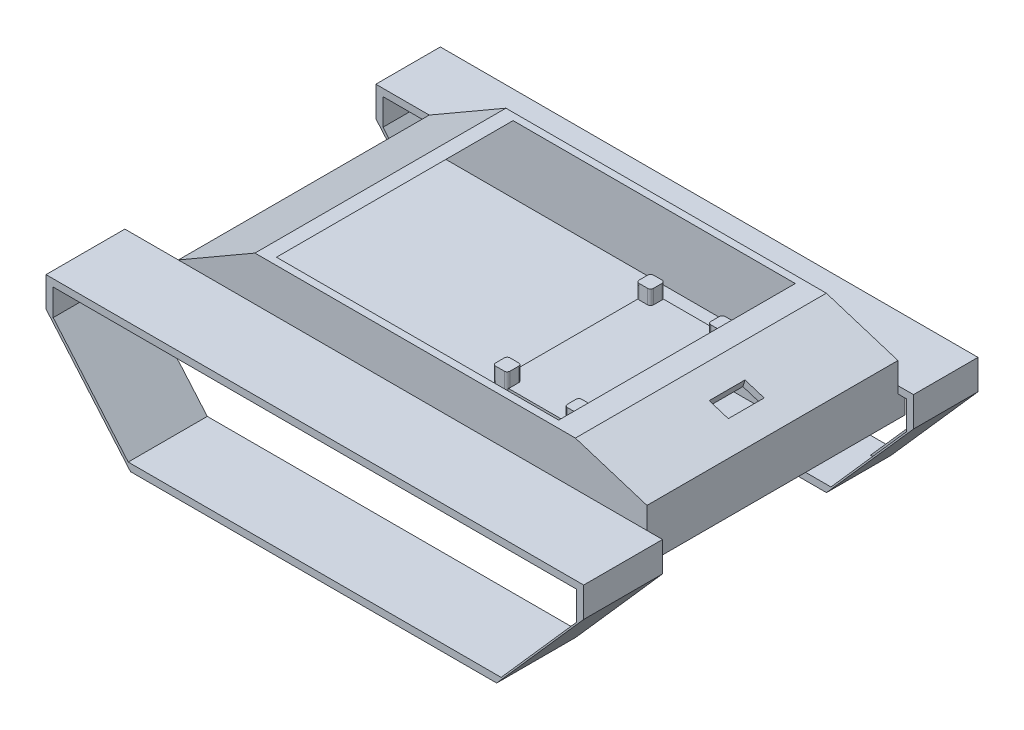
from build123d import *

# Parameters (mm, degrees)
BOSS_EXTRU_1_DEPTH            = 175
COQUE1_T                      = -5
BOSS_EXTRU_3_DEPTH            = 55
BOSS_EXTRU_3_DEPTH_BACK       = 220
ESQUISSE4_W                   = 174.846794054
ESQUISSE4_H                   = 68.749808593
ENL_V_MAT_EXTRU_2_DEPTH       = 440
ESQUISSE5_W                   = 10.839811776
ESQUISSE5_H                   = 175
ESQUISSE5_W_2                 = 37.291999076
ENL_V_MAT_EXTRU_3_DEPTH       = 440
COQUE2_START                  = 180
COQUE2_DEPTH                  = 50
COQUE2_START_2                = -45
COQUE2_2_DEPTH                = 40
COQUE2_START_3                = -5
COQUE2_3_OUTLINE_W            = 316.814624248
COQUE2_3_OUTLINE_H            = 10.798261423
COQUE2_3_DEPTH                = 185
COQUE2_START_4                = 179.846794054
COQUE2_4_DEPTH                = 0.153205946
ESQUISSE6_W                   = 320.386075269
ESQUISSE6_H                   = 165
BOSS_EXTRU_4_DEPTH            = 17
ESQUISSE8_W                   = 10
ESQUISSE8_H                   = 10.798261423
BOSS_EXTRU_5_DEPTH            = 322
ESQUISSE9_W                   = 10
ESQUISSE9_H                   = 10.798261423
BOSS_EXTRU_6_DEPTH            = 322
ESQUISSE10_W                  = 311.818773828
ESQUISSE10_H                  = 165
ENL_V_MAT_EXTRU_5_DEPTH       = 16
ESQUISSE12_W                  = 14
ESQUISSE12_H                  = 25
ENL_V_MAT_EXTRU_7_DEPTH       = 10
ESQUISSE13_W                  = 70
ESQUISSE13_H                  = 40
BOSS_EXTRU_7_DEPTH            = 30
ESQUISSE14_W                  = 60
ESQUISSE14_H                  = 110
BOSS_EXTRU_8_DEPTH            = 30
ESQUISSE15_W                  = 90
ESQUISSE15_H                  = 10
ENL_V_MAT_EXTRU_8_DEPTH       = 64
ESQUISSE16_W                  = 40
ESQUISSE16_H                  = 10
ENL_V_MAT_EXTRU_9_DEPTH       = 118
ESQUISSE17_W                  = 90
ESQUISSE17_H                  = 10
ENL_V_MAT_EXTRU_10_DEPTH      = 1
ESQUISSE18_W                  = 40
ESQUISSE18_H                  = 10.281843274
ENL_V_MAT_EXTRU_11_DEPTH      = 1
ESQUISSE19_W                  = 90
ESQUISSE19_H                  = 10
ENL_V_MAT_EXTRU_12_DEPTH      = 1
ESQUISSE20_W                  = 40
ESQUISSE20_H                  = 10.281843274
ENL_V_MAT_EXTRU_13_DEPTH      = 1
CONG_1_R                      = 2
ENL_V_MAT_EXTRU_14_DEPTH      = 307
ENL_V_MAT_EXTRU_14_DEPTH_BACK = 33


# Read off the part's stored shape, not the designer's step: Coque2
with BuildPart() as part:
    # Esquisse1 → Boss.-Extru.1 (new body)
    with BuildSketch(Plane.XY):
        Polygon((-177.5, -12.8515625), (177.5, -12.8515625), (177.5, 31.452730744), (127.578125, 47.1484375), (-95.881696429, 47.1484375), (-177.5, 0), align=None)
    extrude(amount=BOSS_EXTRU_1_DEPTH)

    # Coque1
    coque1_openings = [part.faces().sort_by_distance(p)[0] for p in [
        (15.848214286, 47.1484375, 87.5),
    ]]
    offset(amount=COQUE1_T, openings=coque1_openings, kind=Kind.INTERSECTION)

    # Esquisse3 → Boss.-Extru.3 (add, two sides: drawn at the far end of the back side and taken through both)
    with BuildSketch(Plane.XY.offset(175).offset(-BOSS_EXTRU_3_DEPTH_BACK)):
        Polygon((127.678215958, -73.266226742), (-127.678215958, -73.266226742), (-186.606623324, -4.516418149), (-186.606623324, 16.281843274), (167.541550352, 16.281843274), (188.339811776, 16.281843274), (188.339811776, -4.516418149), align=None)
    extrude(amount=BOSS_EXTRU_3_DEPTH + BOSS_EXTRU_3_DEPTH_BACK)

    # Esquisse4 → Enlèv. mat.-Extru.2 (cut)
    with BuildSketch(Plane.ZY.offset(186.606623324)):
        with Locations((87.423397027, -38.891322446)):
            Rectangle(ESQUISSE4_W, ESQUISSE4_H)
    extrude(amount=-ENL_V_MAT_EXTRU_2_DEPTH, mode=Mode.SUBTRACT)

    # Esquisse5 → Enlèv. mat.-Extru.3 (cut)
    with BuildSketch(Plane(origin=(0, 16.281843274, 0), x_dir=(1, 0, 0), z_dir=(0, 1, 0))):
        with Locations((182.919905888, -87.5)):
            Rectangle(ESQUISSE5_W, ESQUISSE5_H)
        with Locations((-167.960623786, -87.5)):
            Rectangle(ESQUISSE5_W_2, ESQUISSE5_H)
    extrude(amount=-ENL_V_MAT_EXTRU_3_DEPTH, mode=Mode.SUBTRACT)

    # Coque2 outline → Coque2 (cut)
    with BuildSketch(Plane.XY.offset(COQUE2_START)):
        Polygon((183.339811776, 11.281843274), (-181.606623324, 11.281843274), (-181.606623324, -2.666797768), (-125.378541346, -68.266226742), (125.4218724, -68.266226742), (183.339811776, -2.62589545), align=None)
    extrude(amount=COQUE2_DEPTH, mode=Mode.SUBTRACT)

    # Coque2 2 outline → Coque2 2 (cut)
    with BuildSketch(Plane.XY.offset(COQUE2_START_2)):
        Polygon((183.339811776, 11.281843274), (-181.606623324, 11.281843274), (-181.606623324, -2.666797768), (-125.378541346, -68.266226742), (125.4218724, -68.266226742), (183.339811776, -2.62589545), align=None)
    extrude(amount=COQUE2_2_DEPTH, mode=Mode.SUBTRACT)

    # Coque2 3 outline → Coque2 3 (cut)
    with BuildSketch(Plane.XY.offset(COQUE2_START_3)):
        with Locations((14.092687876, 5.882712563)):
            Rectangle(COQUE2_3_OUTLINE_W, COQUE2_3_OUTLINE_H)
    extrude(amount=COQUE2_3_DEPTH, mode=Mode.SUBTRACT)

    # Coque2 4 outline → Coque2 4 (cut)
    with BuildSketch(Plane.XY.offset(COQUE2_START_4)):
        Polygon((172.5, -14.911015462), (172.5, 0.483581851), (-144.314624248, 0.483581851), (-144.314624248, -46.174130022), (-125.378541346, -68.266226742), (125.4218724, -68.266226742), align=None)
    extrude(amount=COQUE2_4_DEPTH, mode=Mode.SUBTRACT)

    # Esquisse6 → Boss.-Extru.4 (add)
    with BuildSketch(Plane(origin=(0, 16.281843274, 0), x_dir=(1, 0, 0), z_dir=(0, 1, 0))):
        with Locations((12.306962365, -87.5)):
            Rectangle(ESQUISSE6_W, ESQUISSE6_H)
    extrude(amount=-BOSS_EXTRU_4_DEPTH)

    # Esquisse8 → Boss.-Extru.5 (add)
    with BuildSketch(Plane(origin=(-144.314624248, 0, 0), x_dir=(0, 0, -1), z_dir=(1, 0, 0))):
        with Locations((-175, 5.882712563)):
            Rectangle(ESQUISSE8_W, ESQUISSE8_H)
    extrude(amount=BOSS_EXTRU_5_DEPTH)

    # Esquisse9 → Boss.-Extru.6 (add)
    with BuildSketch(Plane.ZY.offset(-172.5)):
        with Locations((0, 5.882712563)):
            Rectangle(ESQUISSE9_W, ESQUISSE9_H)
    extrude(amount=BOSS_EXTRU_6_DEPTH)

    # Esquisse10 → Enlèv. mat.-Extru.5 (cut)
    with BuildSketch(Plane(origin=(0, 16.281843274, 0), x_dir=(1, 0, 0), z_dir=(0, 1, 0))):
        with Locations((16.590613086, -87.5)):
            Rectangle(ESQUISSE10_W, ESQUISSE10_H)
    extrude(amount=-ENL_V_MAT_EXTRU_5_DEPTH, mode=Mode.SUBTRACT)

    # Esquisse12 → Enlèv. mat.-Extru.7 (cut)
    with BuildSketch(Plane(origin=(24.966917974, 79.409954428, 0), x_dir=(0.9539610550737444, -0.2999305009541184, 0), z_dir=(0.2999305009541184, 0.9539610550737445, 0))):
        with Locations((133.728881119, -87.5)):
            Rectangle(ESQUISSE12_W, ESQUISSE12_H)
    extrude(amount=-ENL_V_MAT_EXTRU_7_DEPTH, mode=Mode.SUBTRACT)

    # Esquisse13 → Boss.-Extru.7 (add)
    with BuildSketch(Plane(origin=(0, 0.281843274, 0), x_dir=(1, 0, 0), z_dir=(0, 1, 0))):
        with Locations((137.5, -25)):
            Rectangle(ESQUISSE13_W, ESQUISSE13_H)
        with Locations((137.5, -150)):
            Rectangle(ESQUISSE13_W, ESQUISSE13_H)
    extrude(amount=BOSS_EXTRU_7_DEPTH)

    # Esquisse14 → Boss.-Extru.8 (add)
    with BuildSketch(Plane(origin=(0, 0.281843274, 0), x_dir=(1, 0, 0), z_dir=(0, 1, 0))):
        with Locations((67.5, -87.5)):
            Rectangle(ESQUISSE14_W, ESQUISSE14_H)
    extrude(amount=BOSS_EXTRU_8_DEPTH)

    # Esquisse15 → Enlèv. mat.-Extru.8 (cut)
    with BuildSketch(Plane.ZY.offset(-37.5)):
        with Locations((87.5, 5.281843274)):
            Rectangle(ESQUISSE15_W, ESQUISSE15_H)
        with Locations((87.5, 25.281843274)):
            Rectangle(ESQUISSE15_W, ESQUISSE15_H)
    extrude(amount=-ENL_V_MAT_EXTRU_8_DEPTH, mode=Mode.SUBTRACT)

    # Esquisse16 → Enlèv. mat.-Extru.9 (cut)
    with BuildSketch(Plane(origin=(0, 0, 32.5), x_dir=(-1, 0, 0), z_dir=(0, 0, -1))):
        with Locations((-67.5, 5)):
            Rectangle(ESQUISSE16_W, ESQUISSE16_H)
        with Locations((-67.5, 25.281843274)):
            Rectangle(ESQUISSE16_W, ESQUISSE16_H)
    extrude(amount=-ENL_V_MAT_EXTRU_9_DEPTH, mode=Mode.SUBTRACT)

    # Esquisse17 → Enlèv. mat.-Extru.10 (cut)
    with BuildSketch(Plane.ZY.offset(-37.5)):
        with Locations((87.5, 15.281843274)):
            Rectangle(ESQUISSE17_W, ESQUISSE17_H)
    extrude(amount=-ENL_V_MAT_EXTRU_10_DEPTH, mode=Mode.SUBTRACT)

    # Esquisse18 → Enlèv. mat.-Extru.11 (cut)
    with BuildSketch(Plane(origin=(0, 0, 32.5), x_dir=(-1, 0, 0), z_dir=(0, 0, -1))):
        with Locations((-67.5, 15.140921637)):
            Rectangle(ESQUISSE18_W, ESQUISSE18_H)
    extrude(amount=-ENL_V_MAT_EXTRU_11_DEPTH, mode=Mode.SUBTRACT)

    # Esquisse19 → Enlèv. mat.-Extru.12 (cut)
    with BuildSketch(Plane(origin=(97.5, 0, 0), x_dir=(0, 0, -1), z_dir=(1, 0, 0))):
        with Locations((-87.5, 15.281843274)):
            Rectangle(ESQUISSE19_W, ESQUISSE19_H)
    extrude(amount=-ENL_V_MAT_EXTRU_12_DEPTH, mode=Mode.SUBTRACT)

    # Esquisse20 → Enlèv. mat.-Extru.13 (cut)
    with BuildSketch(Plane.XY.offset(142.5)):
        with Locations((67.5, 15.140921637)):
            Rectangle(ESQUISSE20_W, ESQUISSE20_H)
    extrude(amount=-ENL_V_MAT_EXTRU_13_DEPTH, mode=Mode.SUBTRACT)

    # Congé1
    # the kernel refuses this fillet: 2 mm, written as the material it takes off along each edge
    with BuildSketch(Plane(origin=(87.5, 0.281843274, 132.5), x_dir=(0, 0, 1), z_dir=(0, 1, 0)), Plane(origin=(47.5, 10, 132.5), x_dir=(0, 0, 1), z_dir=(0, -1, 0)), Plane(origin=(47.5, 0.281843274, 42.5), x_dir=(0, 0, -1), z_dir=(0, 1, 0))) as cong_1_piece_1:
        with BuildLine():
            CenterArc((CONG_1_R, CONG_1_R), CONG_1_R, 180, 90)
            Line((0, CONG_1_R), (0, 0))
            Line((0, 0), (CONG_1_R, 0))
        make_face()
    extrude(amount=9.718156726, mode=Mode.SUBTRACT)
    with BuildSketch(Plane(origin=(87.5, 20.281843274, 132.5), x_dir=(0, 0, 1), z_dir=(0, 1, 0)), Plane(origin=(47.5, 35.281843274, 132.5), x_dir=(0, 0, 1), z_dir=(0, -1, 0)), Plane(origin=(47.5, 20.281843274, 42.5), x_dir=(0, 0, -1), z_dir=(0, 1, 0))) as cong_1_piece_2:
        with BuildLine():
            CenterArc((CONG_1_R, CONG_1_R), CONG_1_R, 180, 90)
            Line((0, CONG_1_R), (0, 0))
            Line((0, 0), (CONG_1_R, 0))
        make_face()
    extrude(amount=15, mode=Mode.SUBTRACT)
    with BuildSketch(Plane(origin=(87.5, 0.281843274, 142.5), x_dir=(1, 0, 0), z_dir=(0, 1, 0))) as cong_1_piece_3_section:
        with BuildLine():
            CenterArc((CONG_1_R, CONG_1_R), CONG_1_R, 180, 90)
            Line((0, CONG_1_R), (0, 0))
            Line((0, 0), (CONG_1_R, 0))
        make_face()
    cong_1_piece_3 = extrude(amount=35, mode=Mode.PRIVATE)
    cong_1_piece_3 = split(cong_1_piece_3, bisect_by=Plane(origin=(87.988049699, 5.140921637, 141.5), z_dir=(0, 0, 1)), keep=Keep.TOP, mode=Mode.PRIVATE)
    add(cong_1_piece_3, mode=Mode.SUBTRACT)
    with BuildSketch(Plane(origin=(87.5, 0.281843274, 142.5), x_dir=(1, 0, 0), z_dir=(0, 1, 0))) as cong_1_piece_4_section:
        with BuildLine():
            CenterArc((CONG_1_R, CONG_1_R), CONG_1_R, 180, 90)
            Line((0, CONG_1_R), (0, 0))
            Line((0, 0), (CONG_1_R, 0))
        make_face()
    cong_1_piece_4 = extrude(amount=35, mode=Mode.PRIVATE)
    cong_1_piece_4 = split(cong_1_piece_4, bisect_by=Plane(origin=(87.579369185, 10, 141.253472775), z_dir=(0, -1, 0)), keep=Keep.TOP, mode=Mode.PRIVATE)
    add(cong_1_piece_4, mode=Mode.SUBTRACT)
    with BuildSketch(Plane(origin=(87.5, -4.718156726, 142.5), x_dir=(1, 0, 0), z_dir=(0, 1, 0))) as cong_1_piece_5_section:
        with BuildLine():
            CenterArc((CONG_1_R, CONG_1_R), CONG_1_R, 180, 90)
            Line((0, CONG_1_R), (0, 0))
            Line((0, 0), (CONG_1_R, 0))
        make_face()
    cong_1_piece_5 = extrude(amount=40, mode=Mode.PRIVATE)
    cong_1_piece_5 = split(cong_1_piece_5, bisect_by=Plane(origin=(87.579369185, 20.281843274, 141.253472775), z_dir=(0, 1, 0)), keep=Keep.TOP, mode=Mode.PRIVATE)
    add(cong_1_piece_5, mode=Mode.SUBTRACT)
    with BuildSketch(Plane(origin=(97.5, 0.281843274, 142.5), x_dir=(-1, 0, 0), z_dir=(0, 1, 0))) as cong_1_piece_6:
        with BuildLine():
            CenterArc((CONG_1_R, -CONG_1_R), CONG_1_R, 90, 90)
            Line((0, -CONG_1_R), (0, 0))
            Line((0, 0), (CONG_1_R, 0))
        make_face()
    extrude(amount=35, mode=Mode.SUBTRACT)
    with BuildSketch(Plane(origin=(97.5, 0.281843274, 132.5), x_dir=(-1, 0, 0), z_dir=(0, 1, 0))) as cong_1_piece_7_section:
        with BuildLine():
            CenterArc((CONG_1_R, CONG_1_R), CONG_1_R, 180, 90)
            Line((0, CONG_1_R), (0, 0))
            Line((0, 0), (CONG_1_R, 0))
        make_face()
    cong_1_piece_7 = extrude(amount=35, mode=Mode.PRIVATE)
    cong_1_piece_7 = split(cong_1_piece_7, bisect_by=Plane(origin=(96.253472775, 10.281843274, 132.579369185), z_dir=(0, -1, 0)), keep=Keep.TOP, mode=Mode.PRIVATE)
    add(cong_1_piece_7, mode=Mode.SUBTRACT)
    with BuildSketch(Plane(origin=(97.5, -4.718156726, 132.5), x_dir=(-1, 0, 0), z_dir=(0, 1, 0))) as cong_1_piece_8_section:
        with BuildLine():
            CenterArc((CONG_1_R, CONG_1_R), CONG_1_R, 180, 90)
            Line((0, CONG_1_R), (0, 0))
            Line((0, 0), (CONG_1_R, 0))
        make_face()
    cong_1_piece_8 = extrude(amount=40, mode=Mode.PRIVATE)
    cong_1_piece_8 = split(cong_1_piece_8, bisect_by=Plane(origin=(97.14320814, 10.281843274, 132.988049699), z_dir=(0, 1, 0)), keep=Keep.TOP, mode=Mode.PRIVATE)
    cong_1_piece_8 = split(cong_1_piece_8, bisect_by=Plane(origin=(96.5, 15.281843274, 132.988049699), z_dir=(1, 0, 0)), keep=Keep.TOP, mode=Mode.PRIVATE)
    add(cong_1_piece_8, mode=Mode.SUBTRACT)
    with BuildSketch(Plane(origin=(97.5, -4.718156726, 132.5), x_dir=(-1, 0, 0), z_dir=(0, 1, 0))) as cong_1_piece_9_section:
        with BuildLine():
            CenterArc((CONG_1_R, CONG_1_R), CONG_1_R, 180, 90)
            Line((0, CONG_1_R), (0, 0))
            Line((0, 0), (CONG_1_R, 0))
        make_face()
    cong_1_piece_9 = extrude(amount=40, mode=Mode.PRIVATE)
    cong_1_piece_9 = split(cong_1_piece_9, bisect_by=Plane(origin=(96.253472775, 20.281843274, 132.579369185), z_dir=(0, 1, 0)), keep=Keep.TOP, mode=Mode.PRIVATE)
    add(cong_1_piece_9, mode=Mode.SUBTRACT)
    with BuildSketch(Plane(origin=(47.5, 35.281843274, 142.5), x_dir=(-1, 0, 0), z_dir=(0, -1, 0))) as cong_1_piece_10_section:
        with BuildLine():
            CenterArc((CONG_1_R, CONG_1_R), CONG_1_R, 180, 90)
            Line((0, CONG_1_R), (0, 0))
            Line((0, 0), (CONG_1_R, 0))
        make_face()
    cong_1_piece_10 = extrude(amount=35, mode=Mode.PRIVATE)
    cong_1_piece_10 = split(cong_1_piece_10, bisect_by=Plane(origin=(47.011950301, 25.281843274, 141.5), z_dir=(0, 0, 1)), keep=Keep.TOP, mode=Mode.PRIVATE)
    add(cong_1_piece_10, mode=Mode.SUBTRACT)
    with BuildSketch(Plane(origin=(47.5, 35.281843274, 142.5), x_dir=(-1, 0, 0), z_dir=(0, -1, 0))) as cong_1_piece_11_section:
        with BuildLine():
            CenterArc((CONG_1_R, CONG_1_R), CONG_1_R, 180, 90)
            Line((0, CONG_1_R), (0, 0))
            Line((0, 0), (CONG_1_R, 0))
        make_face()
    cong_1_piece_11 = extrude(amount=40, mode=Mode.PRIVATE)
    cong_1_piece_11 = split(cong_1_piece_11, bisect_by=Plane(origin=(47.420630815, 20.281843274, 141.253472775), z_dir=(0, 1, 0)), keep=Keep.TOP, mode=Mode.PRIVATE)
    add(cong_1_piece_11, mode=Mode.SUBTRACT)
    with BuildSketch(Plane(origin=(47.5, 35.281843274, 142.5), x_dir=(-1, 0, 0), z_dir=(0, -1, 0))) as cong_1_piece_12_section:
        with BuildLine():
            CenterArc((CONG_1_R, CONG_1_R), CONG_1_R, 180, 90)
            Line((0, CONG_1_R), (0, 0))
            Line((0, 0), (CONG_1_R, 0))
        make_face()
    cong_1_piece_12 = extrude(amount=35, mode=Mode.PRIVATE)
    cong_1_piece_12 = split(cong_1_piece_12, bisect_by=Plane(origin=(47.420630815, 10, 141.253472775), z_dir=(0, -1, 0)), keep=Keep.TOP, mode=Mode.PRIVATE)
    add(cong_1_piece_12, mode=Mode.SUBTRACT)
    with BuildSketch(Plane(origin=(37.5, 0.281843274, 142.5), x_dir=(1, 0, 0), z_dir=(0, 1, 0)), Plane(origin=(37.5, 0.281843274, 32.5), x_dir=(0, 0, 1), z_dir=(0, 1, 0)), Plane(origin=(97.5, 0.281843274, 32.5), x_dir=(-1, 0, 0), z_dir=(0, 1, 0))) as cong_1_piece_13:
        with BuildLine():
            CenterArc((CONG_1_R, CONG_1_R), CONG_1_R, 180, 90)
            Line((0, CONG_1_R), (0, 0))
            Line((0, 0), (CONG_1_R, 0))
        make_face()
    extrude(amount=35, mode=Mode.SUBTRACT)
    with BuildSketch(Plane(origin=(37.5, 0.281843274, 132.5), x_dir=(0, 0, 1), z_dir=(0, 1, 0))) as cong_1_piece_14_section:
        with BuildLine():
            CenterArc((CONG_1_R, CONG_1_R), CONG_1_R, 180, 90)
            Line((0, CONG_1_R), (0, 0))
            Line((0, 0), (CONG_1_R, 0))
        make_face()
    cong_1_piece_14 = extrude(amount=35, mode=Mode.PRIVATE)
    cong_1_piece_14 = split(cong_1_piece_14, bisect_by=Plane(origin=(38.5, 5.281843274, 132.988049699), z_dir=(-1, 0, 0)), keep=Keep.TOP, mode=Mode.PRIVATE)
    add(cong_1_piece_14, mode=Mode.SUBTRACT)
    with BuildSketch(Plane(origin=(37.5, 0.281843274, 132.5), x_dir=(0, 0, 1), z_dir=(0, 1, 0))) as cong_1_piece_15_section:
        with BuildLine():
            CenterArc((CONG_1_R, CONG_1_R), CONG_1_R, 180, 90)
            Line((0, CONG_1_R), (0, 0))
            Line((0, 0), (CONG_1_R, 0))
        make_face()
    cong_1_piece_15 = extrude(amount=35, mode=Mode.PRIVATE)
    cong_1_piece_15 = split(cong_1_piece_15, bisect_by=Plane(origin=(38.746527225, 10.281843274, 132.579369185), z_dir=(0, -1, 0)), keep=Keep.TOP, mode=Mode.PRIVATE)
    add(cong_1_piece_15, mode=Mode.SUBTRACT)
    with BuildSketch(Plane(origin=(37.5, -4.718156726, 132.5), x_dir=(0, 0, 1), z_dir=(0, 1, 0))) as cong_1_piece_16_section:
        with BuildLine():
            CenterArc((CONG_1_R, CONG_1_R), CONG_1_R, 180, 90)
            Line((0, CONG_1_R), (0, 0))
            Line((0, 0), (CONG_1_R, 0))
        make_face()
    cong_1_piece_16 = extrude(amount=40, mode=Mode.PRIVATE)
    cong_1_piece_16 = split(cong_1_piece_16, bisect_by=Plane(origin=(38.746527225, 20.281843274, 132.579369185), z_dir=(0, 1, 0)), keep=Keep.TOP, mode=Mode.PRIVATE)
    add(cong_1_piece_16, mode=Mode.SUBTRACT)
    with BuildSketch(Plane(origin=(87.5, 10, 42.5), x_dir=(1, 0, 0), z_dir=(0, -1, 0))) as cong_1_piece_17:
        with BuildLine():
            CenterArc((CONG_1_R, -CONG_1_R), CONG_1_R, 90, 90)
            Line((0, -CONG_1_R), (0, 0))
            Line((0, 0), (CONG_1_R, 0))
        make_face()
    extrude(amount=9.718156726, mode=Mode.SUBTRACT)
    with BuildSketch(Plane(origin=(37.5, 35.281843274, 42.5), x_dir=(0, 0, -1), z_dir=(0, -1, 0))) as cong_1_piece_18_section:
        with BuildLine():
            CenterArc((CONG_1_R, CONG_1_R), CONG_1_R, 180, 90)
            Line((0, CONG_1_R), (0, 0))
            Line((0, 0), (CONG_1_R, 0))
        make_face()
    cong_1_piece_18 = extrude(amount=35, mode=Mode.PRIVATE)
    cong_1_piece_18 = split(cong_1_piece_18, bisect_by=Plane(origin=(38.5, 25.281843274, 42.011950301), z_dir=(-1, 0, 0)), keep=Keep.TOP, mode=Mode.PRIVATE)
    add(cong_1_piece_18, mode=Mode.SUBTRACT)
    with BuildSketch(Plane(origin=(37.5, 35.281843274, 42.5), x_dir=(0, 0, -1), z_dir=(0, -1, 0))) as cong_1_piece_19_section:
        with BuildLine():
            CenterArc((CONG_1_R, CONG_1_R), CONG_1_R, 180, 90)
            Line((0, CONG_1_R), (0, 0))
            Line((0, 0), (CONG_1_R, 0))
        make_face()
    cong_1_piece_19 = extrude(amount=40, mode=Mode.PRIVATE)
    cong_1_piece_19 = split(cong_1_piece_19, bisect_by=Plane(origin=(38.746527225, 20.281843274, 42.420630815), z_dir=(0, 1, 0)), keep=Keep.TOP, mode=Mode.PRIVATE)
    add(cong_1_piece_19, mode=Mode.SUBTRACT)
    with BuildSketch(Plane(origin=(37.5, 35.281843274, 42.5), x_dir=(0, 0, -1), z_dir=(0, -1, 0))) as cong_1_piece_20_section:
        with BuildLine():
            CenterArc((CONG_1_R, CONG_1_R), CONG_1_R, 180, 90)
            Line((0, CONG_1_R), (0, 0))
            Line((0, 0), (CONG_1_R, 0))
        make_face()
    cong_1_piece_20 = extrude(amount=35, mode=Mode.PRIVATE)
    cong_1_piece_20 = split(cong_1_piece_20, bisect_by=Plane(origin=(38.746527225, 10.281843274, 42.420630815), z_dir=(0, -1, 0)), keep=Keep.TOP, mode=Mode.PRIVATE)
    add(cong_1_piece_20, mode=Mode.SUBTRACT)
    with BuildSketch(Plane(origin=(47.5, 35.281843274, 32.5), x_dir=(0, 0, 1), z_dir=(0, -1, 0))) as cong_1_piece_21_section:
        with BuildLine():
            CenterArc((CONG_1_R, CONG_1_R), CONG_1_R, 180, 90)
            Line((0, CONG_1_R), (0, 0))
            Line((0, 0), (CONG_1_R, 0))
        make_face()
    cong_1_piece_21 = extrude(amount=40, mode=Mode.PRIVATE)
    cong_1_piece_21 = split(cong_1_piece_21, bisect_by=Plane(origin=(47.420630815, 20.281843274, 33.746527225), z_dir=(0, 1, 0)), keep=Keep.TOP, mode=Mode.PRIVATE)
    add(cong_1_piece_21, mode=Mode.SUBTRACT)
    with BuildSketch(Plane(origin=(47.5, 35.281843274, 32.5), x_dir=(0, 0, 1), z_dir=(0, -1, 0))) as cong_1_piece_22_section:
        with BuildLine():
            CenterArc((CONG_1_R, CONG_1_R), CONG_1_R, 180, 90)
            Line((0, CONG_1_R), (0, 0))
            Line((0, 0), (CONG_1_R, 0))
        make_face()
    cong_1_piece_22 = extrude(amount=35, mode=Mode.PRIVATE)
    cong_1_piece_22 = split(cong_1_piece_22, bisect_by=Plane(origin=(47.011950301, 15.140921637, 33.5), z_dir=(0, 0, -1)), keep=Keep.TOP, mode=Mode.PRIVATE)
    add(cong_1_piece_22, mode=Mode.SUBTRACT)
    with BuildSketch(Plane(origin=(47.5, 35.281843274, 32.5), x_dir=(0, 0, 1), z_dir=(0, -1, 0))) as cong_1_piece_23_section:
        with BuildLine():
            CenterArc((CONG_1_R, CONG_1_R), CONG_1_R, 180, 90)
            Line((0, CONG_1_R), (0, 0))
            Line((0, 0), (CONG_1_R, 0))
        make_face()
    cong_1_piece_23 = extrude(amount=35, mode=Mode.PRIVATE)
    cong_1_piece_23 = split(cong_1_piece_23, bisect_by=Plane(origin=(47.420630815, 10, 33.746527225), z_dir=(0, -1, 0)), keep=Keep.TOP, mode=Mode.PRIVATE)
    add(cong_1_piece_23, mode=Mode.SUBTRACT)
    with BuildSketch(Plane(origin=(87.5, 35.281843274, 32.5), x_dir=(1, 0, 0), z_dir=(0, -1, 0))) as cong_1_piece_24_section:
        with BuildLine():
            CenterArc((CONG_1_R, CONG_1_R), CONG_1_R, 180, 90)
            Line((0, CONG_1_R), (0, 0))
            Line((0, 0), (CONG_1_R, 0))
        make_face()
    cong_1_piece_24 = extrude(amount=35, mode=Mode.PRIVATE)
    cong_1_piece_24 = split(cong_1_piece_24, bisect_by=Plane(origin=(87.988049699, 25.281843274, 33.5), z_dir=(0, 0, -1)), keep=Keep.TOP, mode=Mode.PRIVATE)
    add(cong_1_piece_24, mode=Mode.SUBTRACT)
    with BuildSketch(Plane(origin=(87.5, 35.281843274, 32.5), x_dir=(1, 0, 0), z_dir=(0, -1, 0))) as cong_1_piece_25_section:
        with BuildLine():
            CenterArc((CONG_1_R, CONG_1_R), CONG_1_R, 180, 90)
            Line((0, CONG_1_R), (0, 0))
            Line((0, 0), (CONG_1_R, 0))
        make_face()
    cong_1_piece_25 = extrude(amount=40, mode=Mode.PRIVATE)
    cong_1_piece_25 = split(cong_1_piece_25, bisect_by=Plane(origin=(87.579369185, 20.281843274, 33.746527225), z_dir=(0, 1, 0)), keep=Keep.TOP, mode=Mode.PRIVATE)
    add(cong_1_piece_25, mode=Mode.SUBTRACT)
    with BuildSketch(Plane(origin=(87.5, 35.281843274, 32.5), x_dir=(1, 0, 0), z_dir=(0, -1, 0))) as cong_1_piece_26_section:
        with BuildLine():
            CenterArc((CONG_1_R, CONG_1_R), CONG_1_R, 180, 90)
            Line((0, CONG_1_R), (0, 0))
            Line((0, 0), (CONG_1_R, 0))
        make_face()
    cong_1_piece_26 = extrude(amount=35, mode=Mode.PRIVATE)
    cong_1_piece_26 = split(cong_1_piece_26, bisect_by=Plane(origin=(87.579369185, 10, 33.746527225), z_dir=(0, -1, 0)), keep=Keep.TOP, mode=Mode.PRIVATE)
    add(cong_1_piece_26, mode=Mode.SUBTRACT)
    with BuildSketch(Plane(origin=(87.5, 35.281843274, 42.5), x_dir=(1, 0, 0), z_dir=(0, -1, 0))) as cong_1_piece_27:
        with BuildLine():
            CenterArc((CONG_1_R, -CONG_1_R), CONG_1_R, 90, 90)
            Line((0, -CONG_1_R), (0, 0))
            Line((0, 0), (CONG_1_R, 0))
        make_face()
    extrude(amount=15, mode=Mode.SUBTRACT)
    with BuildSketch(Plane(origin=(97.5, 0.281843274, 42.5), x_dir=(0, 0, -1), z_dir=(0, 1, 0))) as cong_1_piece_28_section:
        with BuildLine():
            CenterArc((CONG_1_R, CONG_1_R), CONG_1_R, 180, 90)
            Line((0, CONG_1_R), (0, 0))
            Line((0, 0), (CONG_1_R, 0))
        make_face()
    cong_1_piece_28 = extrude(amount=35, mode=Mode.PRIVATE)
    cong_1_piece_28 = split(cong_1_piece_28, bisect_by=Plane(origin=(96.5, 5.281843274, 42.011950301), z_dir=(1, 0, 0)), keep=Keep.TOP, mode=Mode.PRIVATE)
    add(cong_1_piece_28, mode=Mode.SUBTRACT)
    with BuildSketch(Plane(origin=(97.5, 0.281843274, 42.5), x_dir=(0, 0, -1), z_dir=(0, 1, 0))) as cong_1_piece_29_section:
        with BuildLine():
            CenterArc((CONG_1_R, CONG_1_R), CONG_1_R, 180, 90)
            Line((0, CONG_1_R), (0, 0))
            Line((0, 0), (CONG_1_R, 0))
        make_face()
    cong_1_piece_29 = extrude(amount=35, mode=Mode.PRIVATE)
    cong_1_piece_29 = split(cong_1_piece_29, bisect_by=Plane(origin=(96.253472775, 10.281843274, 42.420630815), z_dir=(0, -1, 0)), keep=Keep.TOP, mode=Mode.PRIVATE)
    add(cong_1_piece_29, mode=Mode.SUBTRACT)
    with BuildSketch(Plane(origin=(97.5, -4.718156726, 42.5), x_dir=(0, 0, -1), z_dir=(0, 1, 0))) as cong_1_piece_30_section:
        with BuildLine():
            CenterArc((CONG_1_R, CONG_1_R), CONG_1_R, 180, 90)
            Line((0, CONG_1_R), (0, 0))
            Line((0, 0), (CONG_1_R, 0))
        make_face()
    cong_1_piece_30 = extrude(amount=40, mode=Mode.PRIVATE)
    cong_1_piece_30 = split(cong_1_piece_30, bisect_by=Plane(origin=(96.253472775, 20.281843274, 42.420630815), z_dir=(0, 1, 0)), keep=Keep.TOP, mode=Mode.PRIVATE)
    add(cong_1_piece_30, mode=Mode.SUBTRACT)

    # Esquisse22 → Enlèv. mat.-Extru.14 (cut, two sides: drawn at the far end of the back side and taken through both)
    with BuildSketch(Plane.XY.offset(-ENL_V_MAT_EXTRU_14_DEPTH_BACK)):
        with BuildLine():
            Line((-181.606623324, 11.281843274), (-149.5, 11.281843274))
            Line((-149.5, 11.281843274), (-149.5, -4.516418149))
            Line((-149.5, -4.516418149), (175.963538843, -4.516418149))
            ThreePointArc((175.963538843, -4.516418149), (176.789439914, -4.359330237), (177.5, -3.91000457))
            Line((177.5, -3.91000457), (177.5, 11.281843274))
            Line((177.5, 11.281843274), (183.339811776, 11.281843274))
            Line((183.339811776, 11.281843274), (183.339811776, -8.718156726))
            Line((183.339811776, -8.718156726), (130.797397056, -68.266226742))
            Line((130.797397056, -68.266226742), (-129.273992813, -68.266226742))
            Line((-129.273992813, -68.266226742), (-181.606623324, -7.211491146))
            Line((-181.606623324, -7.211491146), (-181.606623324, 11.281843274))
        make_face()
    extrude(amount=ENL_V_MAT_EXTRU_14_DEPTH + ENL_V_MAT_EXTRU_14_DEPTH_BACK, mode=Mode.SUBTRACT)


solid = part.part
